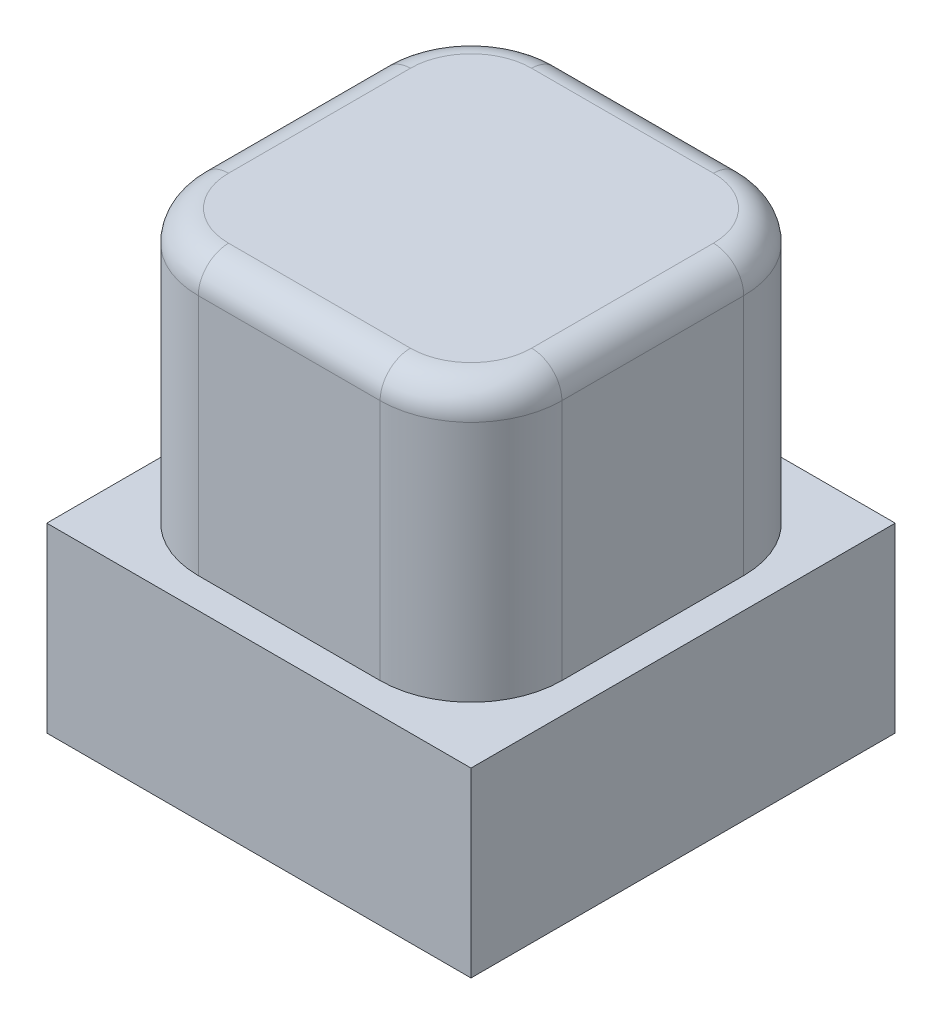
from build123d import *

# Parameters (mm, degrees)
SKETCH_1_W          = 6
SKETCH_1_H          = 6
EXTRUDE_1_DEPTH     = 4.5
FILLET_1_R          = 1.5
FILLET_3_R          = 0.5
SKETCH_2_W          = 7
SKETCH_2_H          = 7
EXTRUDE_2_DEPTH     = 4.7
SKETCH_5_W          = 7
SKETCH_5_H          = 7
CUT_EXTRUDE_1_DEPTH = 1.7


with BuildPart() as part:
    # 草图1 → 凸台-拉伸1 (new body)
    with BuildSketch(Plane(origin=(0, 0, 0), x_dir=(1, 0, 0), z_dir=(0, 1, 0))):
        Rectangle(SKETCH_1_W, SKETCH_1_H)
    extrude(amount=EXTRUDE_1_DEPTH)

    # 圆角1
    fillet_1_edges = [part.edges().sort_by_distance(p)[0] for p in [
        (3, 2.25, 3),
        (-3, 2.25, 3),
        (-3, 2.25, -3),
        (3, 2.25, -3),
    ]]
    fillet(fillet_1_edges, radius=FILLET_1_R)

    # 圆角3
    fillet_3_edges = [part.edges().sort_by_distance(p)[0] for p in [
        (-3, 4.5, 0),
        (0, 4.5, -3),
        (3, 4.5, 0),
        (0, 4.5, 3),
        (-2.560660172, 4.5, 2.560660172),
        (2.560660172, 4.5, 2.560660172),
        (2.560660172, 4.5, -2.560660172),
        (-2.560660172, 4.5, -2.560660172),
    ]]
    fillet(fillet_3_edges, radius=FILLET_3_R)

    # 草图2 → 凸台-拉伸2 (add)
    with BuildSketch(Plane.XZ):
        Rectangle(SKETCH_2_W, SKETCH_2_H)
    extrude(amount=EXTRUDE_2_DEPTH)

    # 切除-放样1: read off the stored shape, not the designer's step
    # 切除-放样1: loft between two sections, ruled curve by curve
    loft_1_from = [
        Edge.make_bspline([(1.999712209, -4.7, -0.033927573), (1.931857063, -4.7, -4.033351992), (-2.067567356, -4.7, -3.965496845), (-1.999712209, -4.7, 0.033927573), (-1.931857063, -4.7, 4.033351992), (2.067567356, -4.7, 3.965496845), (1.999712209, -4.7, -0.033927573)], [0, 0, 0, 0, 0.5, 0.5, 0.5, 1, 1, 1, 1], 3, [1, 0.333333333, 0.333333333, 1, 0.333333333, 0.333333333, 1]),
    ]
    loft_1_to = [
        Edge.make_bspline([(1.873751703, 0.3, 0.314729335), (2.503210373, 0.3, -3.432774072), (-1.244293034, 0.3, -4.062232741), (-1.873751703, 0.3, -0.314729335), (-2.503210373, 0.3, 3.432774072), (1.244293034, 0.3, 4.062232741), (1.873751703, 0.3, 0.314729335)], [0, 0, 0, 0, 0.5, 0.5, 0.5, 1, 1, 1, 1], 3, [1, 0.333333333, 0.333333333, 1, 0.333333333, 0.333333333, 1]),
    ]
    loft_1 = Solid(Shell([*[Face.make_surface_from_curves(loft_1_from[k], loft_1_to[k]) for k in range(1)], Face(Wire(loft_1_from)), Face(Wire(loft_1_to))]))
    add(loft_1, mode=Mode.SUBTRACT)

    # 草图5 → 切除-拉伸1 (cut)
    with BuildSketch(Plane.XZ.offset(4.7)):
        Rectangle(SKETCH_5_W, SKETCH_5_H)
    extrude(amount=-CUT_EXTRUDE_1_DEPTH, mode=Mode.SUBTRACT)


solid = part.part
